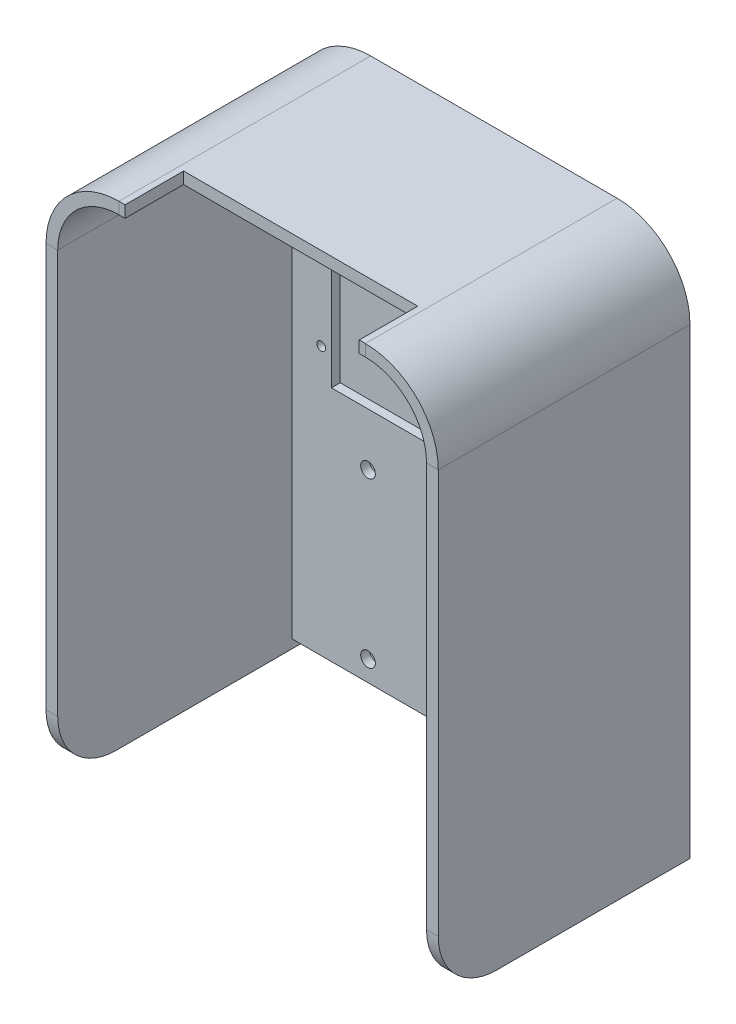
from build123d import *

# Parameters (mm, degrees)
SKETCH_1_W           = 63
SKETCH_1_H           = 70
EXTRUDE_1_DEPTH      = 3
CUT_EXTRUDE_1_REACH  = 96.223
SKETCH_2_R           = 0.75
SKETCH_3_W           = 17
SKETCH_3_H           = 1.5
CUT_EXTRUDE_2_DEPTH  = 28
SKETCH_4_R           = 11
CUT_EXTRUDE_3_DEPTH  = 95.223139409
CUT_EXTRUDE_5_REACH  = 96.223
SKETCH_6_R           = 1.25
SKETCH_7_R           = 2.5
CUT_EXTRUDE_6_DEPTH  = 1.5
SKETCH_9_W           = 7
SKETCH_9_H           = 10
EXTRUDE_2_DEPTH      = 3
SKETCH_10_W          = 10
SKETCH_10_H          = 38
EXTRUDE_3_DEPTH      = 3
SKETCH_11_W          = 18
SKETCH_11_H          = 38
EXTRUDE_4_DEPTH      = 3
SKETCH_12_W          = 2
SKETCH_12_H          = 70
EXTRUDE_5_DEPTH      = 43
SWEEP_1_DEPTH        = 43
SWEEP_1_2_DEPTH      = 3
CUT_EXTRUDE_7_DEPTH  = 122.249642508
SKETCH_16_R          = 11
CUT_EXTRUDE_9_DEPTH  = 120.11538863
SKETCH_21_W          = 63
SKETCH_21_H          = 1.5
CUT_EXTRUDE_10_DEPTH = 3
CUT_EXTRUDE_11_REACH = 122.156
SKETCH_23_W          = 40
SKETCH_23_H          = 10


# Read off the part's stored shape, not the designer's step: 扫描1
with BuildPart() as part:
    # 草图1 → 凸台-拉伸1 (new body)
    with BuildSketch(Plane.XY):
        with Locations((31.5, 35)):
            Rectangle(SKETCH_1_W, SKETCH_1_H)
    extrude(amount=EXTRUDE_1_DEPTH)

    # 草图2 → 切除-拉伸1 (cut, up to next)
    with BuildSketch(Plane.XY.offset(3), mode=Mode.PRIVATE) as cut_extrude_1_sk1:
        with Locations((5, 68)):
            Circle(SKETCH_2_R)
    cut_extrude_1_tool1 = extrude(cut_extrude_1_sk1.sketch, amount=-CUT_EXTRUDE_1_REACH, mode=Mode.PRIVATE) & part.part
    # 草图2 → 切除-拉伸1 (cut, up to next)
    with BuildSketch(Plane.XY.offset(3), mode=Mode.PRIVATE) as cut_extrude_1_sk2:
        with Locations((5, 47.3)):
            Circle(SKETCH_2_R)
    cut_extrude_1_tool2 = extrude(cut_extrude_1_sk2.sketch, amount=-CUT_EXTRUDE_1_REACH, mode=Mode.PRIVATE) & part.part
    # 草图2 → 切除-拉伸1 (cut, up to next)
    with BuildSketch(Plane.XY.offset(3), mode=Mode.PRIVATE) as cut_extrude_1_sk3:
        with Locations((25.5, 47.3)):
            Circle(SKETCH_2_R)
    cut_extrude_1_tool3 = extrude(cut_extrude_1_sk3.sketch, amount=-CUT_EXTRUDE_1_REACH, mode=Mode.PRIVATE) & part.part
    # 草图2 → 切除-拉伸1 (cut, up to next)
    with BuildSketch(Plane.XY.offset(3), mode=Mode.PRIVATE) as cut_extrude_1_sk4:
        with Locations((25.5, 68)):
            Circle(SKETCH_2_R)
    cut_extrude_1_tool4 = extrude(cut_extrude_1_sk4.sketch, amount=-CUT_EXTRUDE_1_REACH, mode=Mode.PRIVATE) & part.part
    cut_extrude_1_1 = cut_extrude_1_tool1.solids().sort_by_distance((5, 68, 3))[0]
    add(cut_extrude_1_1, mode=Mode.SUBTRACT)
    cut_extrude_1_2 = cut_extrude_1_tool2.solids().sort_by_distance((5, 47.3, 3))[0]
    add(cut_extrude_1_2, mode=Mode.SUBTRACT)
    cut_extrude_1_3 = cut_extrude_1_tool3.solids().sort_by_distance((25.5, 47.3, 3))[0]
    add(cut_extrude_1_3, mode=Mode.SUBTRACT)
    cut_extrude_1_4 = cut_extrude_1_tool4.solids().sort_by_distance((25.5, 68, 3))[0]
    add(cut_extrude_1_4, mode=Mode.SUBTRACT)
    cut_extrude_1 = cut_extrude_1_1 + cut_extrude_1_2 + cut_extrude_1_3 + cut_extrude_1_4  # 切除-拉伸1 as one shape, for the pattern or mirror that repeats it

    # 草图3 → 切除-拉伸2 (cut)
    with BuildSketch(Plane(origin=(0, 70, 0), x_dir=(1, 0, 0), z_dir=(0, 1, 0))):
        with Locations((15.25, -2.25)):
            Rectangle(SKETCH_3_W, SKETCH_3_H)
    cut_extrude_2 = extrude(amount=-CUT_EXTRUDE_2_DEPTH, mode=Mode.SUBTRACT)

    # 草图4 → 切除-拉伸3 (cut, through all)
    with BuildSketch(Plane(origin=(0, 0, 0), x_dir=(-1, 0, 0), z_dir=(0, 0, -1))):
        with Locations((-15.25, 75)):
            Circle(SKETCH_4_R)
    cut_extrude_3 = extrude(amount=-CUT_EXTRUDE_3_DEPTH, mode=Mode.SUBTRACT)

    # 镜向1: 切除-拉伸1, 切除-拉伸2, 切除-拉伸3 across plane
    add(cut_extrude_1.mirror(Plane.ZY.offset(-31.5)), mode=Mode.SUBTRACT)
    add(cut_extrude_2.mirror(Plane.ZY.offset(-31.5)), mode=Mode.SUBTRACT)
    add(cut_extrude_3.mirror(Plane.ZY.offset(-31.5)), mode=Mode.SUBTRACT)

    # 草图6 → 切除-拉伸5 (cut, up to next)
    with BuildSketch(Plane(origin=(0, 0, 0), x_dir=(-1, 0, 0), z_dir=(0, 0, -1)), mode=Mode.PRIVATE) as cut_extrude_5_sk1:
        with Locations((-50, 5)):
            Circle(SKETCH_6_R)
    cut_extrude_5_tool1 = extrude(cut_extrude_5_sk1.sketch, amount=-CUT_EXTRUDE_5_REACH, mode=Mode.PRIVATE) & part.part
    # 草图6 → 切除-拉伸5 (cut, up to next)
    with BuildSketch(Plane(origin=(0, 0, 0), x_dir=(-1, 0, 0), z_dir=(0, 0, -1)), mode=Mode.PRIVATE) as cut_extrude_5_sk2:
        with Locations((-50, 33)):
            Circle(SKETCH_6_R)
    cut_extrude_5_tool2 = extrude(cut_extrude_5_sk2.sketch, amount=-CUT_EXTRUDE_5_REACH, mode=Mode.PRIVATE) & part.part
    # 草图6 → 切除-拉伸5 (cut, up to next)
    with BuildSketch(Plane(origin=(0, 0, 0), x_dir=(-1, 0, 0), z_dir=(0, 0, -1)), mode=Mode.PRIVATE) as cut_extrude_5_sk3:
        with Locations((-13, 33)):
            Circle(SKETCH_6_R)
    cut_extrude_5_tool3 = extrude(cut_extrude_5_sk3.sketch, amount=-CUT_EXTRUDE_5_REACH, mode=Mode.PRIVATE) & part.part
    # 草图6 → 切除-拉伸5 (cut, up to next)
    with BuildSketch(Plane(origin=(0, 0, 0), x_dir=(-1, 0, 0), z_dir=(0, 0, -1)), mode=Mode.PRIVATE) as cut_extrude_5_sk4:
        with Locations((-13, 5)):
            Circle(SKETCH_6_R)
    cut_extrude_5_tool4 = extrude(cut_extrude_5_sk4.sketch, amount=-CUT_EXTRUDE_5_REACH, mode=Mode.PRIVATE) & part.part
    add(cut_extrude_5_tool1.solids().sort_by_distance((50, 5, 0))[0], mode=Mode.SUBTRACT)
    add(cut_extrude_5_tool2.solids().sort_by_distance((50, 33, 0))[0], mode=Mode.SUBTRACT)
    add(cut_extrude_5_tool3.solids().sort_by_distance((13, 33, 0))[0], mode=Mode.SUBTRACT)
    add(cut_extrude_5_tool4.solids().sort_by_distance((13, 5, 0))[0], mode=Mode.SUBTRACT)

    # 草图7 → 切除-拉伸6 (cut)
    with BuildSketch(Plane(origin=(0, 0, 0), x_dir=(-1, 0, 0), z_dir=(0, 0, -1))):
        with Locations((-50, 33)):
            Circle(SKETCH_7_R)
        with Locations((-13, 33)):
            Circle(SKETCH_7_R)
        with Locations((-13, 5)):
            Circle(SKETCH_7_R)
        with Locations((-50, 5)):
            Circle(SKETCH_7_R)
    extrude(amount=-CUT_EXTRUDE_6_DEPTH, mode=Mode.SUBTRACT)

    # 草图9 → 凸台-拉伸2 (add)
    with BuildSketch(Plane(origin=(0, 0, 0), x_dir=(-1, 0, 0), z_dir=(0, 0, -1))):
        with Locations((-31.5, 75)):
            Rectangle(SKETCH_9_W, SKETCH_9_H)
    extrude(amount=-EXTRUDE_2_DEPTH)

    # 草图10 → 凸台-拉伸3 (add)
    with BuildSketch(Plane(origin=(0, 0, 0), x_dir=(-1, 0, 0), z_dir=(0, 0, -1))):
        with Locations((-31.5, 19)):
            Rectangle(SKETCH_10_W, SKETCH_10_H)
    extrude(amount=EXTRUDE_3_DEPTH)

    # 草图11 → 凸台-拉伸4 (add)
    with BuildSketch(Plane(origin=(0, 0, -3), x_dir=(-1, 0, 0), z_dir=(0, 0, -1))):
        with Locations((-31.5, 19)):
            Rectangle(SKETCH_11_W, SKETCH_11_H)
    extrude(amount=EXTRUDE_4_DEPTH)

    # 草图12 → 凸台-拉伸5 (add)
    with BuildSketch(Plane(origin=(0, 0, 0), x_dir=(-1, 0, 0), z_dir=(0, 0, -1))):
        with Locations((-64, 35)):
            Rectangle(SKETCH_12_W, SKETCH_12_H)
        with Locations((1, 35)):
            Rectangle(SKETCH_12_W, SKETCH_12_H)
    extrude(amount=-EXTRUDE_5_DEPTH)

    # 扫描1 outline → 扫描1 (add)
    with BuildSketch(Plane.XY):
        with BuildLine():
            ThreePointArc((52.547958971, 89.452041029), (59.93866806, 86.390709089), (63, 79))
            Line((63, 79), (63, 70))
            Line((63, 70), (65, 70))
            Line((65, 70), (65, 79))
            ThreePointArc((65, 79), (61.352881622, 87.804922651), (52.547958971, 91.452041029))
            Line((52.547958971, 91.452041029), (10.452041029, 91.452041029))
            ThreePointArc((10.452041029, 91.452041029), (1.647118378, 87.804922651), (-2, 79))
            Line((-2, 79), (-2, 70))
            Line((-2, 70), (0, 70))
            Line((0, 70), (0, 79))
            ThreePointArc((0, 79), (3.06133194, 86.390709089), (10.452041029, 89.452041029))
            Line((10.452041029, 89.452041029), (52.547958971, 89.452041029))
        make_face()
    extrude(amount=SWEEP_1_DEPTH)

    # Sweep 1 2 outline → Sweep 1 2 (add)
    with BuildSketch(Plane.XY):
        with BuildLine():
            Line((63, 70), (63, 79))
            ThreePointArc((63, 79), (59.93866806, 86.390709089), (52.547958971, 89.452041029))
            Line((52.547958971, 89.452041029), (10.452041029, 89.452041029))
            ThreePointArc((10.452041029, 89.452041029), (3.06133194, 86.390709089), (0, 79))
            Line((0, 79), (0, 70))
            Line((0, 70), (5.452041029, 70))
            Line((5.452041029, 70), (5.452041029, 79))
            ThreePointArc((5.452041029, 79), (6.916507123, 82.535533906), (10.452041029, 84))
            Line((10.452041029, 84), (52.547958971, 84))
            ThreePointArc((52.547958971, 84), (56.083492877, 82.535533906), (57.547958971, 79))
            Line((57.547958971, 79), (57.547958971, 70))
            Line((57.547958971, 70), (63, 70))
        make_face()
    extrude(amount=SWEEP_1_2_DEPTH)

    # 草图15 → 切除-拉伸7 (cut, through all)
    with BuildSketch(Plane.ZY.offset(2)):
        with BuildLine():
            ThreePointArc((43, 10), (40.071067812, 2.928932188), (33, 0))
            Line((33, 0), (43, 0))
            Line((43, 0), (43, 10))
        make_face()
    extrude(amount=-CUT_EXTRUDE_7_DEPTH, mode=Mode.SUBTRACT)

    # 草图16 → 切除-拉伸9 (cut, through all)
    with BuildSketch(Plane.XY.offset(3)):
        with Locations((15.25, 77)):
            Circle(SKETCH_16_R)
        with Locations((47.75, 77)):
            Circle(SKETCH_16_R)
    extrude(amount=-CUT_EXTRUDE_9_DEPTH, mode=Mode.SUBTRACT)

    # 草图21 → 切除-拉伸10 (cut)
    with BuildSketch(Plane.XY.offset(3)):
        with Locations((31.5, 0.75)):
            Rectangle(SKETCH_21_W, SKETCH_21_H)
    extrude(amount=-CUT_EXTRUDE_10_DEPTH, mode=Mode.SUBTRACT)

    # 草图23 → 切除-拉伸11 (cut, up to next)
    with BuildSketch(Plane(origin=(0, 91.452041029, 0), x_dir=(1, 0, 0), z_dir=(0, 1, 0)), mode=Mode.PRIVATE) as cut_extrude_11_sk1:
        with Locations((31.5, -38)):
            Rectangle(SKETCH_23_W, SKETCH_23_H)
    cut_extrude_11_tool1 = extrude(cut_extrude_11_sk1.sketch, amount=-CUT_EXTRUDE_11_REACH, mode=Mode.PRIVATE) & part.part
    add(cut_extrude_11_tool1.solids().sort_by_distance((31.5, 91.452041, 38))[0], mode=Mode.SUBTRACT)


solid = part.part
